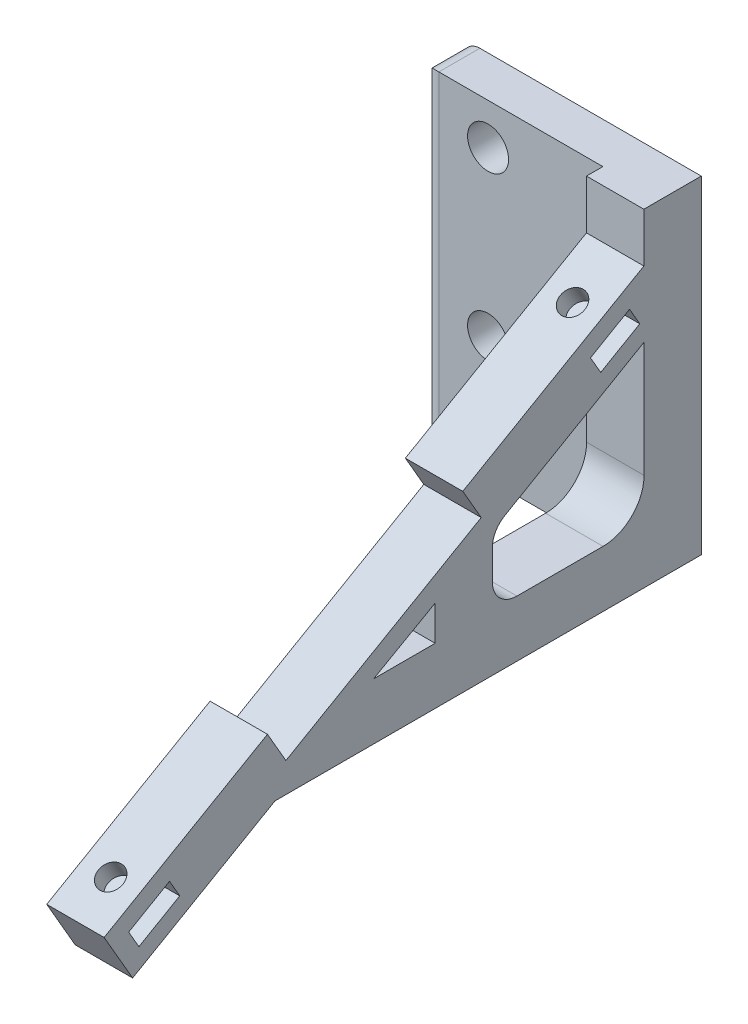
from build123d import *

# Parameters (mm, degrees)
BOSS_EXTRUDE1_DEPTH = 7000
SKETCH8_W           = 29000
SKETCH8_H           = 40000
SKETCH8_R           = 2500
BOSS_EXTRUDE3_DEPTH = 5000
FILLET1_R           = 2000
SKETCH9_R           = 1500
CUT_EXTRUDE1_DEPTH  = 7500


with BuildPart() as part:
    # Sketch1 → Boss-Extrude1 (new body)
    with BuildSketch(Plane(origin=(0, 0, 0), x_dir=(0, 0, -1), z_dir=(1, 0, 0))):
        Polygon((-71013.995318758, 7265.898072848), (-90932.579605801, -4234.101927152), (-87458.303118855, -10251.725322083), (-70107.270427744, -234.101927152), (-18114.648918183, -234.101927152), (-18114.648918183, 39765.898072848), (-25114.648918183, 39765.898072848), (-25114.648918183, 33765.898072848), (-47198.296714686, 21015.898072848), (-44948.296714686, 17118.783755818), (-68763.995318758, 3368.783755818), align=None)
        Polygon((-86690.784266902, -7328.011455498), (-87940.784266902, -5162.947946037), (-82961.138195142, -2287.947946037), (-81711.138195142, -4453.011455498), align=None, mode=Mode.SUBTRACT)
        Polygon((-50564.411297588, 6650.031696168), (-58064.411297588, 6650.031696168), (-50564.411297588, 10900.031696168), align=None, mode=Mode.SUBTRACT)
        with BuildLine():
            Line((-42094.842589731, 15873.015861461), (-25094.842589731, 25713.319742243))
            Line((-25094.842589731, 25713.319742243), (-25094.842589731, 11650.031696168))
            ThreePointArc((-25094.842589731, 11650.031696168), (-26559.308683798, 8114.497790235), (-30094.842589731, 6650.031696168))
            Line((-30094.842589731, 6650.031696168), (-40594.842589731, 6650.031696168))
            ThreePointArc((-40594.842589731, 6650.031696168), (-42716.16293329, 7528.711352608), (-43594.842589731, 9650.031696168))
            Line((-43594.842589731, 9650.031696168), (-43594.842589731, 13271.583512645))
            ThreePointArc((-43594.842589731, 13271.583512645), (-43192.9789446, 14773.036997228), (-42094.842589731, 15873.015861461))
        make_face(mode=Mode.SUBTRACT)
        Polygon((-30374.7121835, 25159.479548575), (-31627.131141319, 27323.144669173), (-26867.067876003, 30078.466376377), (-25614.648918183, 27914.801255779), align=None, mode=Mode.SUBTRACT)
    extrude(amount=-BOSS_EXTRUDE1_DEPTH)

    # Sketch8 → Boss-Extrude3 (add)
    with BuildSketch(Plane(origin=(0, 0, 18114.648918183), x_dir=(-1, 0, 0), z_dir=(0, 0, -1))):
        with Locations((14500, 19765.898072848)):
            Rectangle(SKETCH8_W, SKETCH8_H)
        with Locations((21000, 14765.898072848)):
            Circle(SKETCH8_R, mode=Mode.SUBTRACT)
        with Locations((21000, 34765.898072848)):
            Circle(SKETCH8_R, mode=Mode.SUBTRACT)
    extrude(amount=-BOSS_EXTRUDE3_DEPTH)

    # Fillet1
    fillet1_edges = [part.edges().sort_by_distance(p)[0] for p in [
        (-29000, -234.101927152, 20614.648918183),
        (-29000, 39765.898072848, 20614.648918183),
        (-29000, 19765.898072848, 23114.648918183),
    ]]
    fillet(fillet1_edges, radius=FILLET1_R)

    # Sketch9 → Cut-Extrude1 (cut)
    with BuildSketch(Plane(origin=(0, 36199.385539773, 20899.724985887), x_dir=(1, 0, 0), z_dir=(0, 0.8660254037844377, 0.5000000000000016))):
        with Locations((-3500, -10868.821249998)):
            Circle(SKETCH9_R)
        with Locations((-3500, -75902.875745792)):
            Circle(SKETCH9_R)
    extrude(amount=-CUT_EXTRUDE1_DEPTH, mode=Mode.SUBTRACT)


solid = part.part
